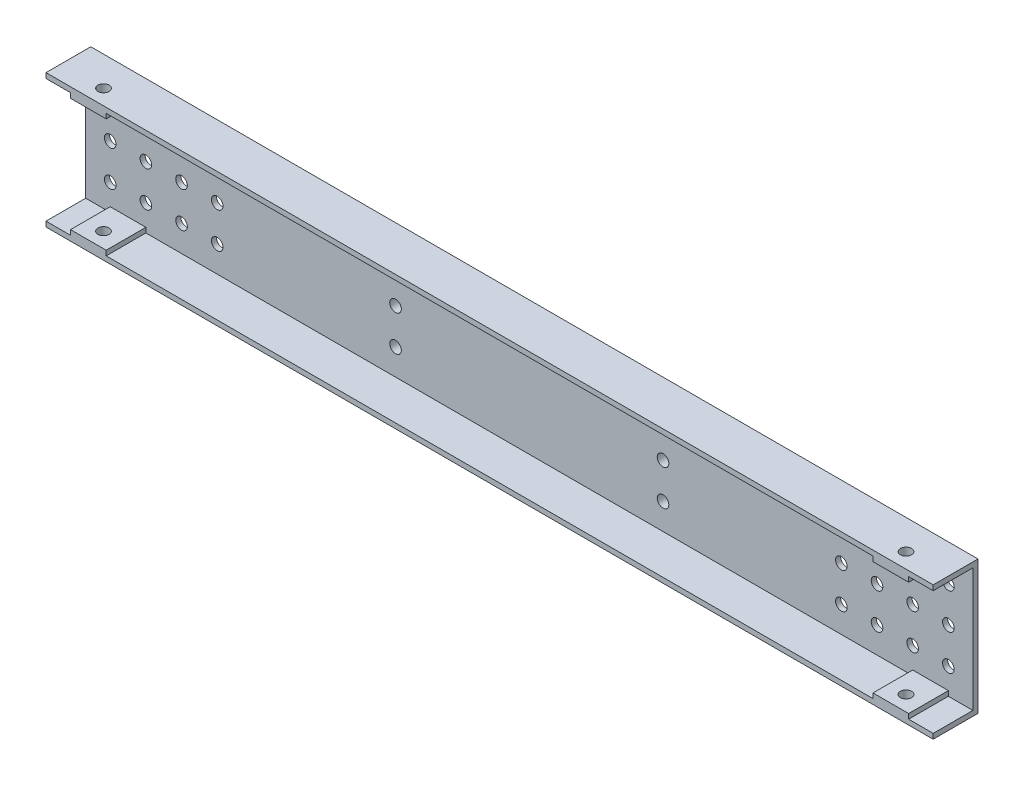
from build123d import *
from build123d.topology import SkipClean

# Parameters (mm, degrees)
SKETCH_1_W             = 1990
SKETCH_1_H             = 300
SKETCH_1_R             = 13
EXTRUDE_395_DEPTH      = 11.5
EXTRUDE_1_DEPTH        = 89
SKETCH_3_R             = 13
CUT_EXTRUDE_1_DEPTH    = 1045.090633039
PATTERN_LINEAR_1_COUNT = 3
PATTERN_LINEAR_1_PITCH = 80
EXTRUDE_START          = 16
SKETCH_7_W             = 70
SKETCH_7_H             = 230
SKETCH_7_R             = 13
EXTRUDE_2_DEPTH        = 16
SKETCH_8_R             = 12.5
CUT_EXTRUDE_2_DEPTH    = 1045.090633039


with BuildPart() as part:
    # 草图1 → Extrude 395 (new body)
    with BuildSketch(Plane.XY):
        with Locations((0, 150)):
            Rectangle(SKETCH_1_W, SKETCH_1_H)
        with Locations((300, 230)):
            Circle(SKETCH_1_R, mode=Mode.SUBTRACT)
        with Locations((300, 150)):
            Circle(SKETCH_1_R, mode=Mode.SUBTRACT)
        with Locations((300, 70)):
            Circle(SKETCH_1_R, mode=Mode.SUBTRACT)
        with Locations((-300, 70)):
            Circle(SKETCH_1_R, mode=Mode.SUBTRACT)
        with Locations((-300, 150)):
            Circle(SKETCH_1_R, mode=Mode.SUBTRACT)
        with Locations((-300, 230)):
            Circle(SKETCH_1_R, mode=Mode.SUBTRACT)
    extrude(amount=EXTRUDE_395_DEPTH)

    # 草图2 → 凸台-拉伸1 (add)
    with BuildSketch(Plane.XY.offset(11.5)):
        Polygon((-995, 300), (995, 300), (995, 288.5), (940, 288.5), (940, 277.5), (860, 277.5), (860, 288.5), (-860, 288.5), (-860, 277.5), (-940, 277.5), (-940, 288.5), (-995, 288.5), align=None)
        Polygon((-995, 0), (995, 0), (995, 11.5), (940, 11.5), (940, 22.5), (860, 22.5), (860, 11.5), (-860, 11.5), (-860, 22.5), (-940, 22.5), (-940, 11.5), (-995, 11.5), align=None)
    extrude(amount=EXTRUDE_1_DEPTH)

    # 草图3 → 切除-拉伸1 (cut, through all)
    with BuildSketch(Plane(origin=(0, 0, 0), x_dir=(-1, 0, 0), z_dir=(0, 0, -1))):
        with Locations((940, 70)):
            Circle(SKETCH_3_R)
        with Locations((860, 70)):
            Circle(SKETCH_3_R)
        with Locations((780, 70)):
            Circle(SKETCH_3_R)
        with Locations((700, 70)):
            Circle(SKETCH_3_R)
        with Locations((-940, 70)):
            Circle(SKETCH_3_R)
        with Locations((-860, 70)):
            Circle(SKETCH_3_R)
        with Locations((-780, 70)):
            Circle(SKETCH_3_R)
        with Locations((-700, 70)):
            Circle(SKETCH_3_R)
    cut_extrude_1 = extrude(amount=-CUT_EXTRUDE_1_DEPTH, mode=Mode.SUBTRACT)

    # 阵列(线性)1: 切除-拉伸1 ×3
    with Locations(*[(0, i * PATTERN_LINEAR_1_PITCH, 0) for i in range(1, PATTERN_LINEAR_1_COUNT)]):
        add(cut_extrude_1, mode=Mode.SUBTRACT)

    # 草图7 → 凸台-拉伸2 (add)
    # profile 1 of 2: a face of its own
    with SkipClean():  # the faces are left unmerged after this step: merging them gives an invalid solid
        with BuildSketch(Plane(origin=(0, 0, 0), x_dir=(-1, 0, 0), z_dir=(0, 0, -1)).offset(EXTRUDE_START)):
            with Locations((300, 150)):
                Rectangle(SKETCH_7_W, SKETCH_7_H)
            with Locations((300, 230)):
                Circle(SKETCH_7_R, mode=Mode.SUBTRACT)
            with Locations((300, 150)):
                Circle(SKETCH_7_R, mode=Mode.SUBTRACT)
            with Locations((300, 70)):
                Circle(SKETCH_7_R, mode=Mode.SUBTRACT)
        # profile 2 of 2: a face of its own
        with BuildSketch(Plane(origin=(0, 0, 0), x_dir=(-1, 0, 0), z_dir=(0, 0, -1)).offset(EXTRUDE_START)):
            with Locations((-300, 150)):
                Rectangle(SKETCH_7_W, SKETCH_7_H)
            with Locations((-300, 70)):
                Circle(SKETCH_7_R, mode=Mode.SUBTRACT)
            with Locations((-300, 150)):
                Circle(SKETCH_7_R, mode=Mode.SUBTRACT)
            with Locations((-300, 230)):
                Circle(SKETCH_7_R, mode=Mode.SUBTRACT)
        extrude(amount=-EXTRUDE_2_DEPTH)

    # 草图8 → 切除-拉伸2 (cut, through all)
    with SkipClean():  # the faces are left unmerged after this step: merging them gives an invalid solid
        with BuildSketch(Plane(origin=(0, 300, 0), x_dir=(-1, 0, 0), z_dir=(0, 1, 0))):
            with Locations((900, 66.5)):
                Circle(SKETCH_8_R)
            with Locations((-900, 66.5)):
                Circle(SKETCH_8_R)
        extrude(amount=-CUT_EXTRUDE_2_DEPTH, mode=Mode.SUBTRACT)


solid = part.part
